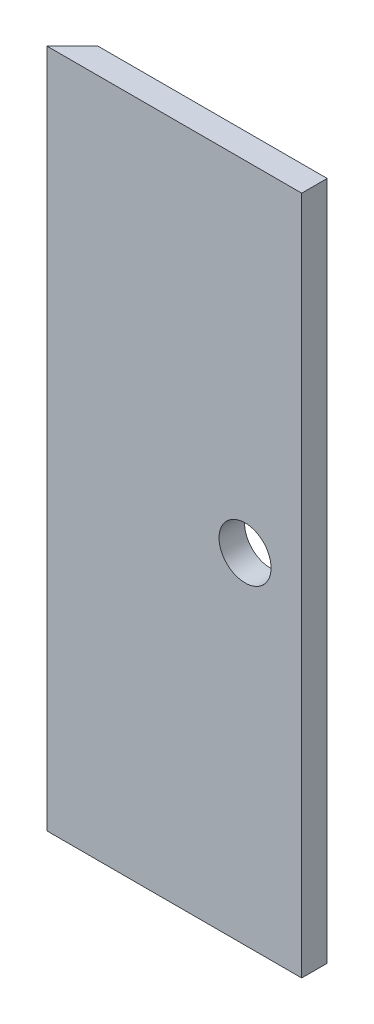
from build123d import *

# Parameters (mm, degrees)
SKETCH1_W           = 180
SKETCH1_H           = 480
SKETCH1_R           = 18.368726539
BOSS_EXTRUDE1_DEPTH = 18
CHAMFER1_SIZE       = 18


with BuildPart() as part:
    # Sketch1 → Boss-Extrude1 (new body)
    with BuildSketch(Plane.XY):
        with Locations((90, 240)):
            Rectangle(SKETCH1_W, SKETCH1_H)
        with Locations((140, 240)):
            Circle(SKETCH1_R, mode=Mode.SUBTRACT)
    extrude(amount=BOSS_EXTRUDE1_DEPTH)

    # Chamfer1
    chamfer1_edges = [part.edges().sort_by_distance(p)[0] for p in [
        (0, 240, 0),
    ]]
    chamfer(chamfer1_edges, length=CHAMFER1_SIZE - 0.0001)  # a hair under: the kernel refuses the full size


solid = part.part
